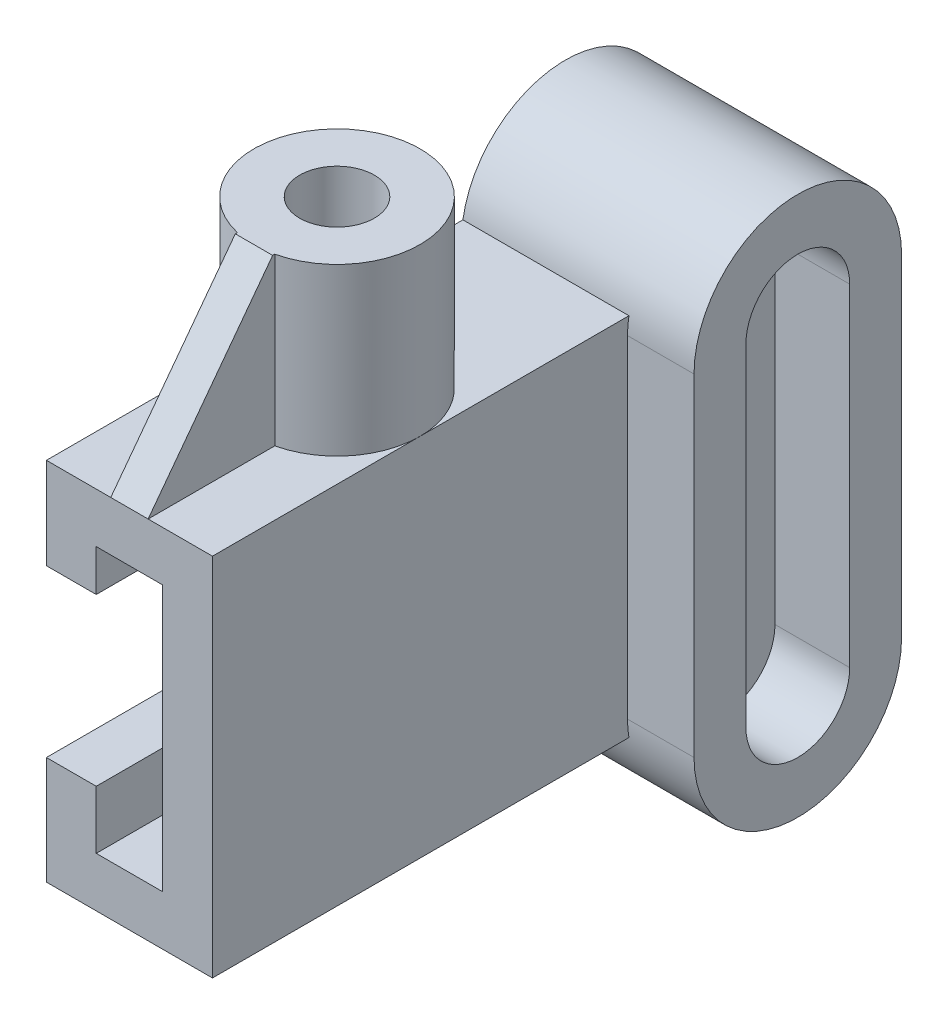
from build123d import *

# Parameters (mm, degrees)
BOSS_EXTRUDE1_DEPTH      = 28
BOSS_EXTRUDE2_DEPTH      = 10
BOSS_EXTRUDE2_DEPTH_BACK = 28
BOSS_EXTRUDE3_DEPTH      = 100
BOSS_EXTRUDE3_DEPTH_BACK = 4
SKETCH4_R                = 20
SKETCH4_R_2              = 9
BOSS_EXTRUDE4_DEPTH      = 40
SKETCH4_2_R              = 9
BOSS_EXTRUDE5_DEPTH      = 8
RIB2_START               = -4.5
RIB2_DEPTH               = 9


with BuildPart() as part:
    # Sketch1 → Boss-Extrude1 (new, symmetric)
    with BuildSketch(Plane(origin=(0, 0, 0), x_dir=(0, 0, -1), z_dir=(1, 0, 0))):
        with BuildLine():
            Line((25, 40), (25, -40))
            ThreePointArc((25, -40), (0, -65), (-25, -40))
            Line((-25, -40), (-25, 40))
            ThreePointArc((-25, 40), (0, 65), (25, 40))
        make_face()
        with BuildLine():
            Line((12.5, 40), (12.5, -40))
            ThreePointArc((12.5, -40), (0, -52.5), (-12.5, -40))
            Line((-12.5, -40), (-12.5, 40))
            ThreePointArc((-12.5, 40), (0, 52.5), (12.5, 40))
        make_face(mode=Mode.SUBTRACT)
    extrude(amount=BOSS_EXTRUDE1_DEPTH, both=True)

    # Sketch1<2> → Boss-Extrude2 (add, two sides: drawn at the far end of the back side and taken through both)
    with BuildSketch(Plane(origin=(0, 0, 0), x_dir=(0, 0, -1), z_dir=(1, 0, 0)).offset(-BOSS_EXTRUDE2_DEPTH_BACK)):
        with BuildLine():
            Line((-12.5, 40), (-12.5, -40))
            ThreePointArc((-12.5, -40), (0, -52.5), (12.5, -40))
            Line((12.5, -40), (12.5, 40))
            ThreePointArc((12.5, 40), (0, 52.5), (-12.5, 40))
        make_face()
    extrude(amount=BOSS_EXTRUDE2_DEPTH + BOSS_EXTRUDE2_DEPTH_BACK)

    # Sketch3 → Boss-Extrude3 (add, two sides: drawn at the far end of the back side and taken through both)
    with BuildSketch(Plane.XY.offset(25).offset(-BOSS_EXTRUDE3_DEPTH_BACK)):
        Polygon((-28, 44), (12, 44), (12, -44), (-28, -44), (-28, -18), (-16, -18), (-16, -32), (0, -32), (0, 32), (-16, 32), (-16, 22), (-28, 22), align=None)
    extrude(amount=BOSS_EXTRUDE3_DEPTH + BOSS_EXTRUDE3_DEPTH_BACK)

    # Sketch4 → Boss-Extrude4 (add)
    with BuildSketch(Plane(origin=(0, 44, 0), x_dir=(1, 0, 0), z_dir=(0, 1, 0))):
        with Locations(Location((-8, -75, 0), (0, 0, 180))):
            Circle(SKETCH4_R)
        with Locations(Location((-8, -75, 0), (0, 0, 270))):
            Circle(SKETCH4_R_2, mode=Mode.SUBTRACT)
    extrude(amount=BOSS_EXTRUDE4_DEPTH)

    # Sketch4<2> → Boss-Extrude5 (add)
    with BuildSketch(Plane(origin=(0, 44, 0), x_dir=(1, 0, 0), z_dir=(0, 1, 0))):
        with Locations(Location((-8, -75, 0), (0, 0, 270))):
            Circle(SKETCH4_2_R)
    extrude(amount=BOSS_EXTRUDE5_DEPTH)

    # Rib2: read off the stored shape, not the designer's step
    # Rib2 outline → Rib2 (add)
    with BuildSketch(Plane.ZY.offset(8).offset(RIB2_START)):
        Polygon((95, 84), (94.48717527, 84), (94.48717527, 44), (125, 44), align=None)
    extrude(amount=RIB2_DEPTH)


solid = part.part
